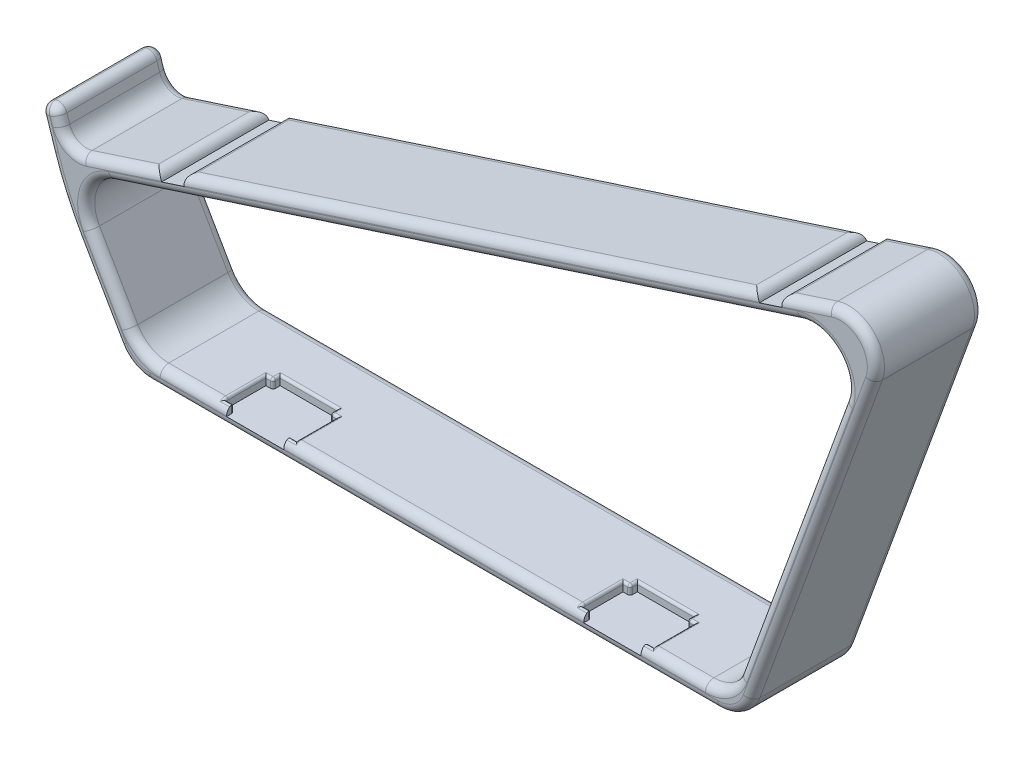
from build123d import *

# Parameters (mm, degrees)
BOSS_EXTRUDE1_DEPTH = 30
FILLET1_R           = 10
FILLET2_R           = 90
FILLET3_R           = 2.5
FILLET4_R           = 5
FILLET6_R           = 2.4
SKETCH17_W          = 25
SKETCH17_H          = 25
CUT_EXTRUDE4_DEPTH  = 1
SKETCH15_W          = 6.7
SKETCH15_H          = 30
CUT_EXTRUDE2_DEPTH  = 2.5
CUT_EXTRUDE3_START  = -30
CUT_EXTRUDE3_DEPTH  = 30.000005
CUT_EXTRUDE1_DEPTH  = 2.5
FILLET5_R           = 0.7


# Some blends are built 0.0001 mm under size
with BuildPart() as part:
    # Sketch13 → Boss-Extrude1 (new body)
    with BuildSketch(Plane.XY):
        Polygon((-98.977787134, 0), (72.829483755, 0), (116.505911867, 120), (-116.505911867, 44.3), (-119.595707786, 53.810686683), (-124.351051127, 52.265788724), (-118.17145929, 33.244415358), align=None)
        Polygon((-115.865710961, 39.250742102), (108.301397672, 112.077304512), (69.328446064, 5), (-96.091035789, 5), align=None, mode=Mode.SUBTRACT)
    extrude(amount=BOSS_EXTRUDE1_DEPTH)

    # Fillet1
    fillet1_edges = [part.edges().sort_by_distance(p)[0] for p in [
        (116.505911867, 120, 15),
        (72.829483755, 0, 15),
        (-98.977787134, 0, 15),
        (-115.865710961, 39.250742102, 15),
        (-96.091035789, 5, 15),
        (69.328446064, 5, 15),
        (108.301397672, 112.077304512, 15),
    ]]
    fillet(fillet1_edges, radius=FILLET1_R)

    # Fillet2
    fillet2_edges = [part.edges().sort_by_distance(p)[0] for p in [
        (-118.17145929, 33.244415358, 15),
    ]]
    fillet(fillet2_edges, radius=FILLET2_R)

    # Fillet3
    fillet3_edges = [part.edges().sort_by_distance(p)[0] for p in [
        (-119.595707786, 53.810686683, 15),
        (-124.351051127, 52.265788724, 15),
    ]]
    fillet(fillet3_edges, radius=FILLET3_R - 0.0001)  # a hair under: the kernel refuses the full size

    # Fillet4
    fillet4_edges = [part.edges().sort_by_distance(p)[0] for p in [
        (-116.505911867, 44.3, 15),
    ]]
    fillet(fillet4_edges, radius=FILLET4_R)

    # Fillet6
    fillet6_edges = [part.edges().sort_by_distance(p)[0] for p in [
        (-118.437049765, 50.24422673, 0),
        (-118.437049765, 50.24422673, 30),
        (-115.565594185, 46.145297954, 0),
        (-115.565594185, 46.145297954, 30),
        (-7.65897272, 74.404537963, 0),
        (-7.65897272, 74.404537963, 30),
        (-104.334382029, 19.277894512, 0),
        (-104.334382029, 19.277894512, 30),
        (-13.688438035, 0, 0),
        (-13.688438035, 0, 30),
        (-7.371740484, 79.755096833, 0),
        (92.359072133, 53.657103079, 0),
        (-13.995581207, 5, 0),
        (86.50629619, 52.195755335, 0),
        (71.563172737, 1.808479557, 0),
        (-98.204284443, 1.339745962, 0),
        (92.359072133, 53.657103079, 30),
        (-7.371740484, 79.755096833, 30),
        (86.50629619, 52.195755335, 30),
        (-13.995581207, 5, 30),
        (71.563172737, 1.808479557, 30),
        (-98.204284443, 1.339745962, 30),
        (-110.36645668, 37.139652094, 0),
        (-110.36645668, 37.139652094, 30),
        (-95.317533097, 6.339745962, 0),
        (-95.317533097, 6.339745962, 30),
        (68.062135046, 6.808479557, 0),
        (68.062135046, 6.808479557, 30),
        (99.085903878, 103.178355791, 0),
        (99.085903878, 103.178355791, 30),
        (107.290418073, 111.101051279, 0),
        (107.290418073, 111.101051279, 30),
        (-107.652706274, 15.0254007, 0),
        (-107.652706274, 15.0254007, 30),
        (-117.718398708, 33.446120251, 0),
        (-117.718398708, 33.446120251, 30),
        (-122.336700459, 46.065425148, 0),
        (-123.428439056, 51.795648689, 0),
        (-120.06584782, 52.888074612, 0),
        (-122.336700459, 46.065425148, 30),
        (-123.428439056, 51.795648689, 30),
        (-120.06584782, 52.888074612, 30),
    ]]
    fillet(fillet6_edges, radius=FILLET6_R)

    # Sketch17 → Cut-Extrude4 (cut)
    with BuildSketch(Plane.XZ):
        with Locations((-76.954284443, 15)):
            Rectangle(SKETCH17_W, SKETCH17_H)
        with Locations((49.577408373, 15)):
            Rectangle(SKETCH17_W, SKETCH17_H)
    extrude(amount=-CUT_EXTRUDE4_DEPTH, mode=Mode.SUBTRACT)

    # Sketch15 → Cut-Extrude2 (cut)
    with BuildSketch(Plane(origin=(-24.140665455, 74.307271912, 0), x_dir=(0.9510686683034012, 0.3089795918367347, 0), z_dir=(-0.3089795918367347, 0.9510686683034012, 0))):
        with Locations((-66.617326531, -15)):
            Rectangle(SKETCH15_W, SKETCH15_H)
        with Locations((109.382673469, -15)):
            Rectangle(SKETCH15_W, SKETCH15_H)
    extrude(amount=-CUT_EXTRUDE2_DEPTH, mode=Mode.SUBTRACT)

    # Sketch16 → Cut-Extrude3 (cut)
    with BuildSketch(Plane.XY.offset(30).offset(CUT_EXTRUDE3_START)):
        with BuildLine():
            Line((74.326016428, 106.296755102), (76.703688099, 107.069204082))
            Line((76.703688099, 107.069204082), (77.476137078, 104.691532411))
            ThreePointArc((77.476137078, 104.691532411), (76.233529258, 106.146555105), (74.326016428, 106.296755102))
        make_face()
        with BuildLine():
            Line((83.075848176, 109.139367347), (83.848297156, 106.761695676))
            ThreePointArc((83.848297156, 106.761695676), (83.998497153, 108.669208506), (85.453519847, 109.911816327))
            Line((85.453519847, 109.911816327), (83.075848176, 109.139367347))
        make_face()
        with BuildLine():
            Line((-90.684397523, 52.688795918), (-89.911948543, 50.311124248))
            ThreePointArc((-89.911948543, 50.311124248), (-91.154556364, 51.766146941), (-93.062069193, 51.916346939))
            Line((-93.062069193, 51.916346939), (-90.684397523, 52.688795918))
        make_face()
        with BuildLine():
            Line((-81.934565774, 55.531408163), (-84.312237445, 54.758959184))
            Line((-84.312237445, 54.758959184), (-83.539788466, 52.381287513))
            ThreePointArc((-83.539788466, 52.381287513), (-83.389588468, 54.288800343), (-81.934565774, 55.531408163))
        make_face()
    extrude(amount=CUT_EXTRUDE3_DEPTH, mode=Mode.SUBTRACT)

    # Sketch14 → Cut-Extrude1 (cut)
    with BuildSketch(Plane(origin=(0, 5, 0), x_dir=(1, 0, 0), z_dir=(0, 1, 0))):
        Polygon((-73.71354484, -17), (-73.71354484, -27.6), (-53.71354484, -27.6), (-53.71354484, -17), (-55.71354484, -17), (-55.71354484, -15), (-71.71354484, -15), (-71.71354484, -17), align=None)
        Polygon((26.28645516, -17), (26.28645516, -27.6), (46.28645516, -27.6), (46.28645516, -17), (44.28645516, -17), (44.28645516, -15), (28.28645516, -15), (28.28645516, -17), align=None)
        Polygon((46.28645516, -27.6), (26.28645516, -27.6), (26.28645516, -28), (28.28645516, -28), (28.28645516, -30), (44.28645516, -30), (44.28645516, -28), (46.28645516, -28), align=None)
        Polygon((-71.71354484, -28), (-71.71354484, -30), (-55.71354484, -30), (-55.71354484, -28), (-53.71354484, -28), (-53.71354484, -27.6), (-73.71354484, -27.6), (-73.71354484, -28), align=None)
    extrude(amount=-CUT_EXTRUDE1_DEPTH, mode=Mode.SUBTRACT)

    # Fillet5
    # the kernel refuses this fillet: 0.7 mm, written as the material it takes off along each edge
    with BuildSketch(Plane(origin=(44.98645516, 4.3, 16.3), x_dir=(-1, 0, 0), z_dir=(0, 1, 0))) as fillet5_piece_1_section:
        Polygon((0, 0), (FILLET5_R, 0), (FILLET5_R, FILLET5_R), (0, FILLET5_R), align=None)
    fillet5_piece_1 = extrude(amount=FILLET5_R, mode=Mode.PRIVATE)
    fillet5_piece_1 = fillet5_piece_1 - Plane(origin=(44.98645516, 4.3, 16.3), x_dir=(0.7071067811865475, 0, -0.7071067811865475), z_dir=(0, 1, 0)) * Sphere(FILLET5_R, mode=Mode.PRIVATE)
    add(fillet5_piece_1, mode=Mode.SUBTRACT)
    with BuildSketch(Plane(origin=(27.58645516, 4.3, 16.3), x_dir=(1, 0, 0), z_dir=(0, 0, 1))) as fillet5_piece_2_section:
        Polygon((0, 0), (FILLET5_R, 0), (FILLET5_R, FILLET5_R), (0, FILLET5_R), align=None)
    fillet5_piece_2 = extrude(amount=FILLET5_R, mode=Mode.PRIVATE)
    fillet5_piece_2 = fillet5_piece_2 - Plane(origin=(27.58645516, 4.3, 16.3), x_dir=(-0.7071067811865474, -0.7071067811865477, 0), z_dir=(0, 0, 1)) * Sphere(FILLET5_R, mode=Mode.PRIVATE)
    add(fillet5_piece_2, mode=Mode.SUBTRACT)
    with BuildSketch(Plane(origin=(-55.01354484, 4.3, 16.3), x_dir=(-1, 0, 0), z_dir=(0, 1, 0))) as fillet5_piece_3_section:
        Polygon((0, 0), (FILLET5_R, 0), (FILLET5_R, FILLET5_R), (0, FILLET5_R), align=None)
    fillet5_piece_3 = extrude(amount=FILLET5_R, mode=Mode.PRIVATE)
    fillet5_piece_3 = fillet5_piece_3 - Plane(origin=(-55.01354484, 4.3, 16.3), x_dir=(0.7071067811865475, 0, -0.7071067811865475), z_dir=(0, 1, 0)) * Sphere(FILLET5_R, mode=Mode.PRIVATE)
    add(fillet5_piece_3, mode=Mode.SUBTRACT)
    with BuildSketch(Plane(origin=(-72.41354484, 4.3, 16.3), x_dir=(0, 1, 0), z_dir=(0, 0, 1))) as fillet5_piece_4_section:
        Polygon((0, 0), (FILLET5_R, 0), (FILLET5_R, -FILLET5_R), (0, -FILLET5_R), align=None)
    fillet5_piece_4 = extrude(amount=FILLET5_R, mode=Mode.PRIVATE)
    fillet5_piece_4 = fillet5_piece_4 - Plane(origin=(-72.41354484, 4.3, 16.3), x_dir=(-0.7071067811865474, -0.7071067811865477, 0), z_dir=(0, 0, 1)) * Sphere(FILLET5_R, mode=Mode.PRIVATE)
    add(fillet5_piece_4, mode=Mode.SUBTRACT)
    with BuildSketch(Plane(origin=(-73.71354484, 2.6, 27.6), x_dir=(0, 0.6242555624221722, 0.7812201948138421), z_dir=(0, -0.7812201948138421, 0.6242555624221722))) as fillet5_piece_5_section:
        with BuildLine():
            CenterArc((2.4 - FILLET5_R, FILLET5_R), FILLET5_R, 270, 90)
            Line((2.4 - FILLET5_R, 0), (2.4, 0))
            Line((2.4, 0), (2.4, FILLET5_R))
        make_face()
    fillet5_piece_5 = revolve(axis=Axis((-73.71354484, 2.6, 27.6), (-1, 0, 0)), revolution_arc=51.372431449, mode=Mode.PRIVATE)
    fillet5_piece_5 = split(fillet5_piece_5, bisect_by=Plane(origin=(-73.871949815, 4.829325849, 28), z_dir=(0, 0, -1)), keep=Keep.TOP, mode=Mode.PRIVATE)
    add(fillet5_piece_5, mode=Mode.SUBTRACT)
    with BuildSketch(Plane(origin=(-68.534328294, 4.966431913, 28), x_dir=(0, -0.42194020781035263, 0.9066236600888796), z_dir=(-1, 0, 0)), Plane(origin=(-53.71354484, 4.966431913, 28), x_dir=(0, -0.42194020781035313, 0.9066236600888794), z_dir=(-1, 0, 0)), Plane(origin=(31.465671706, 4.966431913, 28), x_dir=(0, -0.4219402078103597, 0.9066236600888764), z_dir=(-1, 0, 0)), Plane(origin=(46.28645516, 4.966431913, 28), x_dir=(0, -0.4219402078103608, 0.906623660088876), z_dir=(-1, 0, 0))) as fillet5_piece_6:
        with BuildLine():
            CenterArc((1.08623232, -0.674986447), FILLET5_R, 74.636926578, 130.32021507)
            Line((0.451595758, -0.970344592), (0, 0))
            ThreePointArc((0, 0), (0.635843309, 0.085760754), (1.271686618, 0))
        make_face()
    extrude(amount=5.179216546, mode=Mode.SUBTRACT)
    with BuildSketch(Plane(origin=(-53.71354484, 2.6, 27.6), x_dir=(0, 0.6242555624221753, 0.7812201948138395), z_dir=(0, -0.7812201948138395, 0.6242555624221753))) as fillet5_piece_7_section:
        with BuildLine():
            CenterArc((2.4 - FILLET5_R, -FILLET5_R), FILLET5_R, 0, 90)
            Line((2.4 - FILLET5_R, 0), (2.4, 0))
            Line((2.4, 0), (2.4, -FILLET5_R))
        make_face()
    fillet5_piece_7 = revolve(axis=Axis((-53.71354484, 2.6, 27.6), (-1, 0, 0)), revolution_arc=51.372431449, mode=Mode.PRIVATE)
    fillet5_piece_7 = split(fillet5_piece_7, bisect_by=Plane(origin=(-53.555139871, 4.829325855, 28), z_dir=(0, 0, -1)), keep=Keep.TOP, mode=Mode.PRIVATE)
    add(fillet5_piece_7, mode=Mode.SUBTRACT)
    with BuildSketch(Plane(origin=(26.28645516, 2.6, 27.6), x_dir=(0, 0.62425556242217, 0.781220194813844), z_dir=(0, -0.781220194813844, 0.62425556242217))) as fillet5_piece_8_section:
        with BuildLine():
            CenterArc((2.4 - FILLET5_R, FILLET5_R), FILLET5_R, 270, 90)
            Line((2.4 - FILLET5_R, 0), (2.4, 0))
            Line((2.4, 0), (2.4, FILLET5_R))
        make_face()
    fillet5_piece_8 = revolve(axis=Axis((26.28645516, 2.6, 27.6), (-1, 0, 0)), revolution_arc=51.372431449, mode=Mode.PRIVATE)
    fillet5_piece_8 = split(fillet5_piece_8, bisect_by=Plane(origin=(26.128050185, 4.829325849, 28), z_dir=(0, 0, -1)), keep=Keep.TOP, mode=Mode.PRIVATE)
    add(fillet5_piece_8, mode=Mode.SUBTRACT)
    with BuildSketch(Plane(origin=(46.28645516, 2.6, 27.6), x_dir=(0, 0.6242555624221683, 0.7812201948138452), z_dir=(0, -0.7812201948138452, 0.6242555624221683))) as fillet5_piece_9_section:
        with BuildLine():
            CenterArc((2.4 - FILLET5_R, -FILLET5_R), FILLET5_R, 0, 90)
            Line((2.4 - FILLET5_R, 0), (2.4, 0))
            Line((2.4, 0), (2.4, -FILLET5_R))
        make_face()
    fillet5_piece_9 = revolve(axis=Axis((46.28645516, 2.6, 27.6), (-1, 0, 0)), revolution_arc=51.372431449, mode=Mode.PRIVATE)
    fillet5_piece_9 = split(fillet5_piece_9, bisect_by=Plane(origin=(46.444860129, 4.829325855, 28), z_dir=(0, 0, -1)), keep=Keep.TOP, mode=Mode.PRIVATE)
    add(fillet5_piece_9, mode=Mode.SUBTRACT)
    with BuildSketch(Plane(origin=(46.28645516, 5, 17), x_dir=(1, 0, 0), z_dir=(0, 0, 1)), Plane(origin=(-53.71354484, 5, 17), x_dir=(1, 0, 0), z_dir=(0, 0, 1))) as fillet5_piece_10:
        with BuildLine():
            CenterArc((FILLET5_R, -FILLET5_R), FILLET5_R, 90, 90)
            Line((0, -FILLET5_R), (0, 0))
            Line((0, 0), (FILLET5_R, 0))
        make_face()
    extrude(amount=10.6, mode=Mode.SUBTRACT)
    with BuildSketch(Plane(origin=(46.28645516, 5, 17), x_dir=(0, 0, -1), z_dir=(-1, 0, 0)), Plane(origin=(44.28645516, 5, 16.3), x_dir=(1, 0, 0), z_dir=(0, 0, -1)), Plane(origin=(27.58645516, 5, 17), x_dir=(0, 0, -1), z_dir=(-1, 0, 0)), Plane(origin=(28.28645516, 5, 15), x_dir=(-1, 0, 0), z_dir=(0, 0, 1)), Plane(origin=(-53.71354484, 5, 17), x_dir=(0, 0, -1), z_dir=(-1, 0, 0)), Plane(origin=(-55.71354484, 5, 16.3), x_dir=(1, 0, 0), z_dir=(0, 0, -1)), Plane(origin=(-72.41354484, 5, 17), x_dir=(0, 0, -1), z_dir=(-1, 0, 0)), Plane(origin=(-71.71354484, 5, 15), x_dir=(-1, 0, 0), z_dir=(0, 0, 1))) as fillet5_piece_11:
        with BuildLine():
            CenterArc((FILLET5_R, FILLET5_R), FILLET5_R, 180, 90)
            Line((0, FILLET5_R), (0, 0))
            Line((0, 0), (FILLET5_R, 0))
        make_face()
    extrude(amount=1.3, mode=Mode.SUBTRACT)
    with BuildSketch(Plane(origin=(44.28645516, 5, 15), x_dir=(0, 0, -1), z_dir=(-1, 0, 0)), Plane(origin=(-55.71354484, 5, 15), x_dir=(0, 0, -1), z_dir=(-1, 0, 0))) as fillet5_piece_12:
        with BuildLine():
            CenterArc((FILLET5_R, FILLET5_R), FILLET5_R, 180, 90)
            Line((0, FILLET5_R), (0, 0))
            Line((0, 0), (FILLET5_R, 0))
        make_face()
    extrude(amount=16, mode=Mode.SUBTRACT)
    with BuildSketch(Plane(origin=(26.28645516, 5, 17), x_dir=(-1, 0, 0), z_dir=(0, 0, 1)), Plane(origin=(-73.71354484, 5, 17), x_dir=(-1, 0, 0), z_dir=(0, 0, 1))) as fillet5_piece_13:
        with BuildLine():
            CenterArc((FILLET5_R, FILLET5_R), FILLET5_R, 180, 90)
            Line((0, FILLET5_R), (0, 0))
            Line((0, 0), (FILLET5_R, 0))
        make_face()
    extrude(amount=10.6, mode=Mode.SUBTRACT)
    with BuildSketch(Plane(origin=(28.28645516, 4.3, 17), x_dir=(-1, 0, 0), z_dir=(0, -1, 0)), Plane(origin=(44.28645516, 4.3, 17), x_dir=(0, 0, -1), z_dir=(0, -1, 0)), Plane(origin=(-71.71354484, 4.3, 17), x_dir=(-1, 0, 0), z_dir=(0, -1, 0)), Plane(origin=(-55.71354484, 4.3, 17), x_dir=(0, 0, -1), z_dir=(0, -1, 0))) as fillet5_piece_14:
        with BuildLine():
            CenterArc((FILLET5_R, FILLET5_R), FILLET5_R, 180, 90)
            Line((0, FILLET5_R), (0, 0))
            Line((0, 0), (FILLET5_R, 0))
        make_face()
    extrude(amount=1.8, mode=Mode.SUBTRACT)
    with BuildSketch(Plane(origin=(44.28645516, 6.716431913, 28), x_dir=(0, 0, 1), z_dir=(0, -1, 0)), Plane(origin=(-55.71354484, 6.716431913, 28), x_dir=(0, 0, 1), z_dir=(0, -1, 0))) as fillet5_piece_15:
        with BuildLine():
            CenterArc((FILLET5_R, -FILLET5_R), FILLET5_R, 90, 90)
            Line((0, -FILLET5_R), (0, 0))
            Line((0, 0), (FILLET5_R, 0))
        make_face()
    extrude(amount=4.216431913, mode=Mode.SUBTRACT)
    with BuildSketch(Plane(origin=(28.28645516, 6.716431913, 28), x_dir=(0, 0, 1), z_dir=(0, -1, 0)), Plane(origin=(-71.71354484, 6.716431913, 28), x_dir=(0, 0, 1), z_dir=(0, -1, 0))) as fillet5_piece_16:
        with BuildLine():
            CenterArc((FILLET5_R, FILLET5_R), FILLET5_R, 180, 90)
            Line((0, FILLET5_R), (0, 0))
            Line((0, 0), (FILLET5_R, 0))
        make_face()
    extrude(amount=4.216431913, mode=Mode.SUBTRACT)
    with BuildSketch(Plane(origin=(-68.534328294, 4.966431913, 28), x_dir=(0, -0.42194020781035263, 0.9066236600888796), z_dir=(-1, 0, 0))) as fillet5_piece_17a_section:
        with BuildLine():
            CenterArc((1.08623232, -0.674986447), FILLET5_R, 74.636926578, 130.32021507)
            Line((0.451595758, -0.970344592), (0, 0))
            ThreePointArc((0, 0), (0.635843309, 0.085760754), (1.271686618, 0))
        make_face()
    fillet5_piece_17a = extrude(amount=8.358433092, mode=Mode.PRIVATE)
    fillet5_piece_17a = split(fillet5_piece_17a, bisect_by=Plane(origin=(-73.71354484, 4.631318924, 28.293515063), z_dir=(-1, 0, 0)), keep=Keep.TOP, mode=Mode.PRIVATE)
    with BuildSketch(Plane(origin=(-73.71354484, 2.6, 27.6), x_dir=(0, 0.6242555624221722, 0.7812201948138421), z_dir=(0, -0.7812201948138421, 0.6242555624221722))) as fillet5_piece_17b_section:
        with BuildLine():
            CenterArc((2.4 - FILLET5_R, FILLET5_R), FILLET5_R, 270, 90)
            Line((2.4 - FILLET5_R, 0), (2.4, 0))
            Line((2.4, 0), (2.4, FILLET5_R))
        make_face()
    fillet5_piece_17b = revolve(axis=Axis((-73.71354484, 2.6, 27.6), (-1, 0, 0)), revolution_arc=51.372431449, mode=Mode.PRIVATE)
    fillet5_piece_17b = split(fillet5_piece_17b, bisect_by=Plane(origin=(-73.879542984, 4.494975201, 28), z_dir=(0, 0, 1)), keep=Keep.TOP, mode=Mode.PRIVATE)
    fillet5_piece_17 = fillet5_piece_17a & fillet5_piece_17b
    add(fillet5_piece_17, mode=Mode.SUBTRACT)
    with BuildSketch(Plane(origin=(-53.71354484, 2.6, 27.6), x_dir=(0, 0.6242555624221753, 0.7812201948138395), z_dir=(0, -0.7812201948138395, 0.6242555624221753))) as fillet5_piece_18a_section:
        with BuildLine():
            CenterArc((2.4 - FILLET5_R, -FILLET5_R), FILLET5_R, 0, 90)
            Line((2.4 - FILLET5_R, 0), (2.4, 0))
            Line((2.4, 0), (2.4, -FILLET5_R))
        make_face()
    fillet5_piece_18a = revolve(axis=Axis((-53.71354484, 2.6, 27.6), (-1, 0, 0)), revolution_arc=51.372431449, mode=Mode.PRIVATE)
    fillet5_piece_18a = split(fillet5_piece_18a, bisect_by=Plane(origin=(-53.5475467, 4.4949752, 28), z_dir=(0, 0, 1)), keep=Keep.TOP, mode=Mode.PRIVATE)
    with BuildSketch(Plane(origin=(-50.534328294, 4.966431913, 28), x_dir=(0, -0.42194020781035313, 0.9066236600888794), z_dir=(-1, 0, 0))) as fillet5_piece_18b_section:
        with BuildLine():
            CenterArc((1.08623232, -0.674986447), FILLET5_R, 74.636926578, 130.32021507)
            Line((0.451595758, -0.970344592), (0, 0))
            ThreePointArc((0, 0), (0.635843309, 0.085760754), (1.271686618, 0))
        make_face()
    fillet5_piece_18b = extrude(amount=8.358433092, mode=Mode.PRIVATE)
    fillet5_piece_18b = split(fillet5_piece_18b, bisect_by=Plane(origin=(-53.71354484, 4.631318924, 28.293515063), z_dir=(1, 0, 0)), keep=Keep.TOP, mode=Mode.PRIVATE)
    fillet5_piece_18 = fillet5_piece_18a & fillet5_piece_18b
    add(fillet5_piece_18, mode=Mode.SUBTRACT)
    with BuildSketch(Plane(origin=(31.465671706, 4.966431913, 28), x_dir=(0, -0.4219402078103597, 0.9066236600888764), z_dir=(-1, 0, 0))) as fillet5_piece_19a_section:
        with BuildLine():
            CenterArc((1.08623232, -0.674986447), FILLET5_R, 74.636926578, 130.32021507)
            Line((0.451595758, -0.970344592), (0, 0))
            ThreePointArc((0, 0), (0.635843309, 0.085760754), (1.271686618, 0))
        make_face()
    fillet5_piece_19a = extrude(amount=8.358433092, mode=Mode.PRIVATE)
    fillet5_piece_19a = split(fillet5_piece_19a, bisect_by=Plane(origin=(26.28645516, 4.631318924, 28.293515063), z_dir=(-1, 0, 0)), keep=Keep.TOP, mode=Mode.PRIVATE)
    with BuildSketch(Plane(origin=(26.28645516, 2.6, 27.6), x_dir=(0, 0.62425556242217, 0.781220194813844), z_dir=(0, -0.781220194813844, 0.62425556242217))) as fillet5_piece_19b_section:
        with BuildLine():
            CenterArc((2.4 - FILLET5_R, FILLET5_R), FILLET5_R, 270, 90)
            Line((2.4 - FILLET5_R, 0), (2.4, 0))
            Line((2.4, 0), (2.4, FILLET5_R))
        make_face()
    fillet5_piece_19b = revolve(axis=Axis((26.28645516, 2.6, 27.6), (-1, 0, 0)), revolution_arc=51.372431449, mode=Mode.PRIVATE)
    fillet5_piece_19b = split(fillet5_piece_19b, bisect_by=Plane(origin=(26.120457016, 4.494975201, 28), z_dir=(0, 0, 1)), keep=Keep.TOP, mode=Mode.PRIVATE)
    fillet5_piece_19 = fillet5_piece_19a & fillet5_piece_19b
    add(fillet5_piece_19, mode=Mode.SUBTRACT)
    with BuildSketch(Plane(origin=(46.28645516, 2.6, 27.6), x_dir=(0, 0.6242555624221683, 0.7812201948138452), z_dir=(0, -0.7812201948138452, 0.6242555624221683))) as fillet5_piece_20a_section:
        with BuildLine():
            CenterArc((2.4 - FILLET5_R, -FILLET5_R), FILLET5_R, 0, 90)
            Line((2.4 - FILLET5_R, 0), (2.4, 0))
            Line((2.4, 0), (2.4, -FILLET5_R))
        make_face()
    fillet5_piece_20a = revolve(axis=Axis((46.28645516, 2.6, 27.6), (-1, 0, 0)), revolution_arc=51.372431449, mode=Mode.PRIVATE)
    fillet5_piece_20a = split(fillet5_piece_20a, bisect_by=Plane(origin=(46.4524533, 4.4949752, 28), z_dir=(0, 0, 1)), keep=Keep.TOP, mode=Mode.PRIVATE)
    with BuildSketch(Plane(origin=(49.465671706, 4.966431913, 28), x_dir=(0, -0.4219402078103608, 0.906623660088876), z_dir=(-1, 0, 0))) as fillet5_piece_20b_section:
        with BuildLine():
            CenterArc((1.08623232, -0.674986447), FILLET5_R, 74.636926578, 130.32021507)
            Line((0.451595758, -0.970344592), (0, 0))
            ThreePointArc((0, 0), (0.635843309, 0.085760754), (1.271686618, 0))
        make_face()
    fillet5_piece_20b = extrude(amount=8.358433092, mode=Mode.PRIVATE)
    fillet5_piece_20b = split(fillet5_piece_20b, bisect_by=Plane(origin=(46.28645516, 4.631318924, 28.293515063), z_dir=(1, 0, 0)), keep=Keep.TOP, mode=Mode.PRIVATE)
    fillet5_piece_20 = fillet5_piece_20a & fillet5_piece_20b
    add(fillet5_piece_20, mode=Mode.SUBTRACT)
    with BuildSketch(Plane(origin=(48.03645516, 5, 17), x_dir=(0, 0, -1), z_dir=(-1, 0, 0))) as fillet5_piece_21a_section:
        with BuildLine():
            CenterArc((FILLET5_R, FILLET5_R), FILLET5_R, 180, 90)
            Line((0, FILLET5_R), (0, 0))
            Line((0, 0), (FILLET5_R, 0))
        make_face()
    fillet5_piece_21a = extrude(amount=3.05, mode=Mode.PRIVATE)
    fillet5_piece_21a = split(fillet5_piece_21a, bisect_by=Plane(origin=(46.28645516, 4.84152342, 16.84152342), z_dir=(1, 0, 0)), keep=Keep.TOP, mode=Mode.PRIVATE)
    with BuildSketch(Plane(origin=(46.28645516, 5, 15.25), x_dir=(1, 0, 0), z_dir=(0, 0, 1))) as fillet5_piece_21b_section:
        with BuildLine():
            CenterArc((FILLET5_R, -FILLET5_R), FILLET5_R, 90, 90)
            Line((0, -FILLET5_R), (0, 0))
            Line((0, 0), (FILLET5_R, 0))
        make_face()
    fillet5_piece_21b = extrude(amount=12.35, mode=Mode.PRIVATE)
    fillet5_piece_21b = split(fillet5_piece_21b, bisect_by=Plane(origin=(46.44493174, 4.84152342, 17), z_dir=(0, 0, -1)), keep=Keep.TOP, mode=Mode.PRIVATE)
    fillet5_piece_21 = fillet5_piece_21a & fillet5_piece_21b
    add(fillet5_piece_21, mode=Mode.SUBTRACT)
    with BuildSketch(Plane(origin=(46.03645516, 5, 15), x_dir=(0, 0, -1), z_dir=(-1, 0, 0))) as fillet5_piece_22a_section:
        with BuildLine():
            CenterArc((FILLET5_R, FILLET5_R), FILLET5_R, 180, 90)
            Line((0, FILLET5_R), (0, 0))
            Line((0, 0), (FILLET5_R, 0))
        make_face()
    fillet5_piece_22a = extrude(amount=17.75, mode=Mode.PRIVATE)
    fillet5_piece_22a = split(fillet5_piece_22a, bisect_by=Plane(origin=(44.28645516, 4.84152342, 14.84152342), z_dir=(1, 0, 0)), keep=Keep.TOP, mode=Mode.PRIVATE)
    with BuildSketch(Plane(origin=(44.28645516, 5, 16.3), x_dir=(1, 0, 0), z_dir=(0, 0, -1))) as fillet5_piece_22b_section:
        with BuildLine():
            CenterArc((FILLET5_R, FILLET5_R), FILLET5_R, 180, 90)
            Line((0, FILLET5_R), (0, 0))
            Line((0, 0), (FILLET5_R, 0))
        make_face()
    fillet5_piece_22b = extrude(amount=3.05, mode=Mode.PRIVATE)
    fillet5_piece_22b = split(fillet5_piece_22b, bisect_by=Plane(origin=(44.44493174, 4.84152342, 15), z_dir=(0, 0, -1)), keep=Keep.TOP, mode=Mode.PRIVATE)
    fillet5_piece_22 = fillet5_piece_22a & fillet5_piece_22b
    add(fillet5_piece_22, mode=Mode.SUBTRACT)
    with BuildSketch(Plane(origin=(28.28645516, 5, 13.25), x_dir=(-1, 0, 0), z_dir=(0, 0, 1))) as fillet5_piece_23a_section:
        with BuildLine():
            CenterArc((FILLET5_R, FILLET5_R), FILLET5_R, 180, 90)
            Line((0, FILLET5_R), (0, 0))
            Line((0, 0), (FILLET5_R, 0))
        make_face()
    fillet5_piece_23a = extrude(amount=3.05, mode=Mode.PRIVATE)
    fillet5_piece_23a = split(fillet5_piece_23a, bisect_by=Plane(origin=(28.12797858, 4.84152342, 15), z_dir=(0, 0, -1)), keep=Keep.TOP, mode=Mode.PRIVATE)
    with BuildSketch(Plane(origin=(44.28645516, 5, 15), x_dir=(0, 0, -1), z_dir=(-1, 0, 0))) as fillet5_piece_23b_section:
        with BuildLine():
            CenterArc((FILLET5_R, FILLET5_R), FILLET5_R, 180, 90)
            Line((0, FILLET5_R), (0, 0))
            Line((0, 0), (FILLET5_R, 0))
        make_face()
    fillet5_piece_23b = extrude(amount=17.75, mode=Mode.PRIVATE)
    fillet5_piece_23b = split(fillet5_piece_23b, bisect_by=Plane(origin=(28.28645516, 4.84152342, 14.84152342), z_dir=(-1, 0, 0)), keep=Keep.TOP, mode=Mode.PRIVATE)
    fillet5_piece_23 = fillet5_piece_23a & fillet5_piece_23b
    add(fillet5_piece_23, mode=Mode.SUBTRACT)
    with BuildSketch(Plane(origin=(26.28645516, 5, 15.25), x_dir=(-1, 0, 0), z_dir=(0, 0, 1))) as fillet5_piece_24a_section:
        with BuildLine():
            CenterArc((FILLET5_R, FILLET5_R), FILLET5_R, 180, 90)
            Line((0, FILLET5_R), (0, 0))
            Line((0, 0), (FILLET5_R, 0))
        make_face()
    fillet5_piece_24a = extrude(amount=12.35, mode=Mode.PRIVATE)
    fillet5_piece_24a = split(fillet5_piece_24a, bisect_by=Plane(origin=(26.12797858, 4.84152342, 17), z_dir=(0, 0, -1)), keep=Keep.TOP, mode=Mode.PRIVATE)
    with BuildSketch(Plane(origin=(27.58645516, 5, 17), x_dir=(0, 0, -1), z_dir=(-1, 0, 0))) as fillet5_piece_24b_section:
        with BuildLine():
            CenterArc((FILLET5_R, FILLET5_R), FILLET5_R, 180, 90)
            Line((0, FILLET5_R), (0, 0))
            Line((0, 0), (FILLET5_R, 0))
        make_face()
    fillet5_piece_24b = extrude(amount=3.05, mode=Mode.PRIVATE)
    fillet5_piece_24b = split(fillet5_piece_24b, bisect_by=Plane(origin=(26.28645516, 4.84152342, 16.84152342), z_dir=(-1, 0, 0)), keep=Keep.TOP, mode=Mode.PRIVATE)
    fillet5_piece_24 = fillet5_piece_24a & fillet5_piece_24b
    add(fillet5_piece_24, mode=Mode.SUBTRACT)
    with BuildSketch(Plane(origin=(-51.96354484, 5, 17), x_dir=(0, 0, -1), z_dir=(-1, 0, 0))) as fillet5_piece_25a_section:
        with BuildLine():
            CenterArc((FILLET5_R, FILLET5_R), FILLET5_R, 180, 90)
            Line((0, FILLET5_R), (0, 0))
            Line((0, 0), (FILLET5_R, 0))
        make_face()
    fillet5_piece_25a = extrude(amount=3.05, mode=Mode.PRIVATE)
    fillet5_piece_25a = split(fillet5_piece_25a, bisect_by=Plane(origin=(-53.71354484, 4.84152342, 16.84152342), z_dir=(1, 0, 0)), keep=Keep.TOP, mode=Mode.PRIVATE)
    with BuildSketch(Plane(origin=(-53.71354484, 5, 15.25), x_dir=(1, 0, 0), z_dir=(0, 0, 1))) as fillet5_piece_25b_section:
        with BuildLine():
            CenterArc((FILLET5_R, -FILLET5_R), FILLET5_R, 90, 90)
            Line((0, -FILLET5_R), (0, 0))
            Line((0, 0), (FILLET5_R, 0))
        make_face()
    fillet5_piece_25b = extrude(amount=12.35, mode=Mode.PRIVATE)
    fillet5_piece_25b = split(fillet5_piece_25b, bisect_by=Plane(origin=(-53.55506826, 4.84152342, 17), z_dir=(0, 0, -1)), keep=Keep.TOP, mode=Mode.PRIVATE)
    fillet5_piece_25 = fillet5_piece_25a & fillet5_piece_25b
    add(fillet5_piece_25, mode=Mode.SUBTRACT)
    with BuildSketch(Plane(origin=(-53.96354484, 5, 15), x_dir=(0, 0, -1), z_dir=(-1, 0, 0))) as fillet5_piece_26a_section:
        with BuildLine():
            CenterArc((FILLET5_R, FILLET5_R), FILLET5_R, 180, 90)
            Line((0, FILLET5_R), (0, 0))
            Line((0, 0), (FILLET5_R, 0))
        make_face()
    fillet5_piece_26a = extrude(amount=17.75, mode=Mode.PRIVATE)
    fillet5_piece_26a = split(fillet5_piece_26a, bisect_by=Plane(origin=(-55.71354484, 4.84152342, 14.84152342), z_dir=(1, 0, 0)), keep=Keep.TOP, mode=Mode.PRIVATE)
    with BuildSketch(Plane(origin=(-55.71354484, 5, 16.3), x_dir=(1, 0, 0), z_dir=(0, 0, -1))) as fillet5_piece_26b_section:
        with BuildLine():
            CenterArc((FILLET5_R, FILLET5_R), FILLET5_R, 180, 90)
            Line((0, FILLET5_R), (0, 0))
            Line((0, 0), (FILLET5_R, 0))
        make_face()
    fillet5_piece_26b = extrude(amount=3.05, mode=Mode.PRIVATE)
    fillet5_piece_26b = split(fillet5_piece_26b, bisect_by=Plane(origin=(-55.55506826, 4.84152342, 15), z_dir=(0, 0, -1)), keep=Keep.TOP, mode=Mode.PRIVATE)
    fillet5_piece_26 = fillet5_piece_26a & fillet5_piece_26b
    add(fillet5_piece_26, mode=Mode.SUBTRACT)
    with BuildSketch(Plane(origin=(-73.71354484, 5, 15.25), x_dir=(-1, 0, 0), z_dir=(0, 0, 1))) as fillet5_piece_27a_section:
        with BuildLine():
            CenterArc((FILLET5_R, FILLET5_R), FILLET5_R, 180, 90)
            Line((0, FILLET5_R), (0, 0))
            Line((0, 0), (FILLET5_R, 0))
        make_face()
    fillet5_piece_27a = extrude(amount=12.35, mode=Mode.PRIVATE)
    fillet5_piece_27a = split(fillet5_piece_27a, bisect_by=Plane(origin=(-73.87202142, 4.84152342, 17), z_dir=(0, 0, -1)), keep=Keep.TOP, mode=Mode.PRIVATE)
    with BuildSketch(Plane(origin=(-72.41354484, 5, 17), x_dir=(0, 0, -1), z_dir=(-1, 0, 0))) as fillet5_piece_27b_section:
        with BuildLine():
            CenterArc((FILLET5_R, FILLET5_R), FILLET5_R, 180, 90)
            Line((0, FILLET5_R), (0, 0))
            Line((0, 0), (FILLET5_R, 0))
        make_face()
    fillet5_piece_27b = extrude(amount=3.05, mode=Mode.PRIVATE)
    fillet5_piece_27b = split(fillet5_piece_27b, bisect_by=Plane(origin=(-73.71354484, 4.84152342, 16.84152342), z_dir=(-1, 0, 0)), keep=Keep.TOP, mode=Mode.PRIVATE)
    fillet5_piece_27 = fillet5_piece_27a & fillet5_piece_27b
    add(fillet5_piece_27, mode=Mode.SUBTRACT)
    with BuildSketch(Plane(origin=(-71.71354484, 5, 13.25), x_dir=(-1, 0, 0), z_dir=(0, 0, 1))) as fillet5_piece_28a_section:
        with BuildLine():
            CenterArc((FILLET5_R, FILLET5_R), FILLET5_R, 180, 90)
            Line((0, FILLET5_R), (0, 0))
            Line((0, 0), (FILLET5_R, 0))
        make_face()
    fillet5_piece_28a = extrude(amount=3.05, mode=Mode.PRIVATE)
    fillet5_piece_28a = split(fillet5_piece_28a, bisect_by=Plane(origin=(-71.87202142, 4.84152342, 15), z_dir=(0, 0, -1)), keep=Keep.TOP, mode=Mode.PRIVATE)
    with BuildSketch(Plane(origin=(-55.71354484, 5, 15), x_dir=(0, 0, -1), z_dir=(-1, 0, 0))) as fillet5_piece_28b_section:
        with BuildLine():
            CenterArc((FILLET5_R, FILLET5_R), FILLET5_R, 180, 90)
            Line((0, FILLET5_R), (0, 0))
            Line((0, 0), (FILLET5_R, 0))
        make_face()
    fillet5_piece_28b = extrude(amount=17.75, mode=Mode.PRIVATE)
    fillet5_piece_28b = split(fillet5_piece_28b, bisect_by=Plane(origin=(-71.71354484, 4.84152342, 14.84152342), z_dir=(-1, 0, 0)), keep=Keep.TOP, mode=Mode.PRIVATE)
    fillet5_piece_28 = fillet5_piece_28a & fillet5_piece_28b
    add(fillet5_piece_28, mode=Mode.SUBTRACT)


solid = part.part
